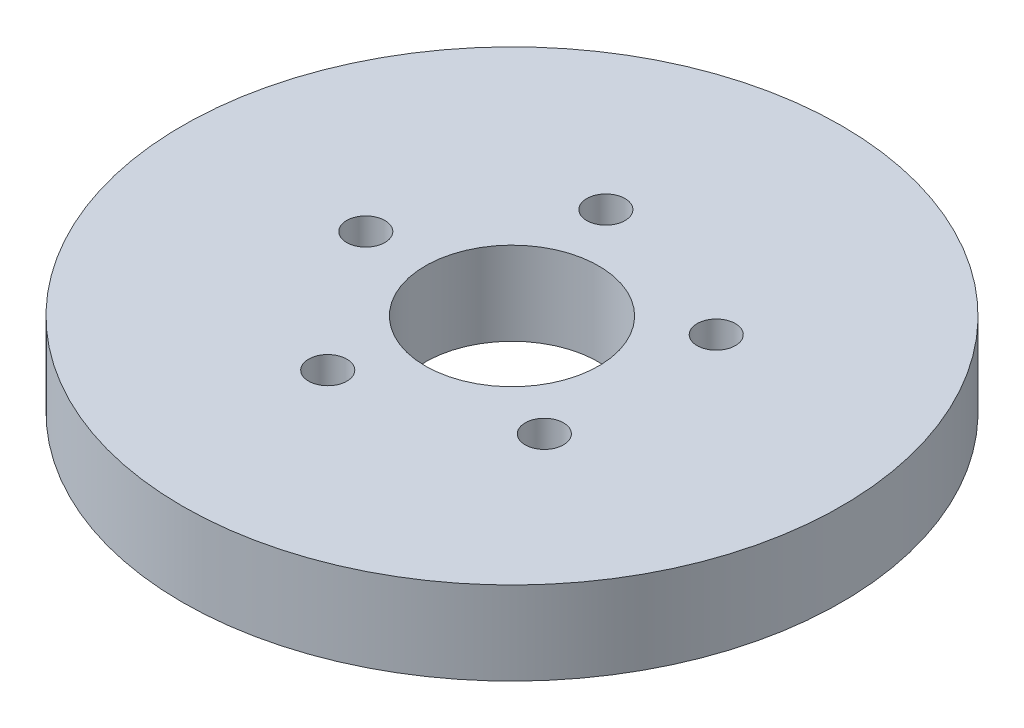
from build123d import *

# Parameters (mm, degrees)
SKETCH1_R           = 95
BOSS_EXTRUDE1_DEPTH = 24
SKETCH2_R           = 25
CUT_EXTRUDE1_DEPTH  = 137.477104307
SKETCH3_R           = 5.516058589
CUT_EXTRUDE2_DEPTH  = 18.435031028
CIRPATTERN1_COUNT   = 5


with BuildPart() as part:
    # Sketch1 → Boss-Extrude1 (new body)
    with BuildSketch(Plane(origin=(0, 0, 0), x_dir=(1, 0, 0), z_dir=(0, 1, 0))):
        Circle(SKETCH1_R)
    extrude(amount=BOSS_EXTRUDE1_DEPTH)

    # Sketch2 → Cut-Extrude1 (cut, through all)
    with BuildSketch(Plane(origin=(0, 0, 0), x_dir=(1, 0, 0), z_dir=(0, 1, 0))):
        Circle(SKETCH2_R)
    extrude(amount=CUT_EXTRUDE1_DEPTH, mode=Mode.SUBTRACT)

    # Sketch3 → Cut-Extrude2 (cut)
    with BuildSketch(Plane(origin=(0, 24, 0), x_dir=(1, 0, 0), z_dir=(0, 1, 0))):
        with Locations((-42.149427327, 0)):
            Circle(SKETCH3_R)
    cut_extrude2 = extrude(amount=-CUT_EXTRUDE2_DEPTH, mode=Mode.SUBTRACT)

    # CirPattern1: Cut-Extrude2 ×5 about axis
    cirpattern1_axis = Axis((0, 0, 0), (0, 1, 0))
    for i in range(1, CIRPATTERN1_COUNT):
        add(cut_extrude2.rotate(cirpattern1_axis, i * 360 / CIRPATTERN1_COUNT), mode=Mode.SUBTRACT)


solid = part.part
